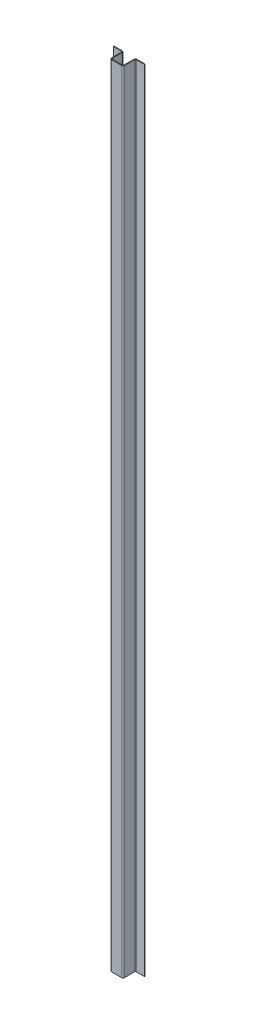
from build123d import *

# Parameters (mm, degrees)
SKETCH1_W                      = 40
SKETCH1_H                      = 2428
BASE_FLANGE1_DEPTH             = 2
EDGE_FLANGE1_STRIP_W           = 13
EDGE_FLANGE1_STRIP_H           = 2
EDGE_FLANGE1_STRIP_CUT_DEPTH   = 2428
EDGE_FLANGE1_STRIP_2_W         = 13
EDGE_FLANGE1_STRIP_2_H         = 2
EDGE_FLANGE1_STRIP_CUT_2_DEPTH = 2428
EDGE_FLANGE1_DEPTH             = 2428
EDGE_FLANGE1_BEND_DEPTH        = 2428
EDGE_FLANGE2_STRIP_W           = 13
EDGE_FLANGE2_STRIP_H           = 2
EDGE_FLANGE2_STRIP_CUT_DEPTH   = 2428
EDGE_FLANGE2_STRIP_2_W         = 13
EDGE_FLANGE2_STRIP_2_H         = 2
EDGE_FLANGE2_STRIP_CUT_2_DEPTH = 2428
EDGE_FLANGE2_DEPTH             = 2428
EDGE_FLANGE2_BEND_DEPTH        = 2428


# Sheet-metal steps are written as plain solids
with BuildPart() as part:
    # Sketch1 → Base-Flange1 (new body)
    with BuildSketch(Plane.XY):
        Rectangle(SKETCH1_W, SKETCH1_H)
    extrude(amount=-BASE_FLANGE1_DEPTH)

    # Edge-Flange1 strip (across the edge) → Edge-Flange1 strip cut (cut)
    with BuildSketch(Plane(origin=(20, 1214, -2), x_dir=(-1, 0, 0), z_dir=(0, -1, 0))):
        with Locations((-2, -1)):
            Rectangle(EDGE_FLANGE1_STRIP_W, EDGE_FLANGE1_STRIP_H)
    extrude(amount=EDGE_FLANGE1_STRIP_CUT_DEPTH, mode=Mode.SUBTRACT)

    # Edge-Flange1 strip 2 (across the edge) → Edge-Flange1 strip cut 2 (cut)
    with BuildSketch(Plane(origin=(-20, -1214, -2), x_dir=(1, 0, 0), z_dir=(0, 1, 0))):
        with Locations((-2, -1)):
            Rectangle(EDGE_FLANGE1_STRIP_2_W, EDGE_FLANGE1_STRIP_2_H)
    extrude(amount=EDGE_FLANGE1_STRIP_CUT_2_DEPTH, mode=Mode.SUBTRACT)

    # Edge-Flange1 section (across the edge) → Edge-Flange1 (add)
    with BuildSketch(Plane(origin=(20, 1214, -2), x_dir=(-1, 0, 0), z_dir=(0, -1, 0))):
        with BuildLine():
            Line((0, 2.5), (0, 38))
            Line((0, 38), (2, 38))
            Line((2, 38), (2, 2.5))
            ThreePointArc((2, 2.5), (2.732233047, 0.732233047), (4.5, 0))
            Line((4.5, 0), (4.5, -2))
            ThreePointArc((4.5, -2), (1.318019485, -0.681980515), (0, 2.5))
        make_face()
    extrude(amount=EDGE_FLANGE1_DEPTH)

    # Edge-Flange1 section 2 (across the edge) → Edge-Flange1 bend (add)
    with BuildSketch(Plane(origin=(-20, -1214, -2), x_dir=(1, 0, 0), z_dir=(0, 1, 0))):
        with BuildLine():
            Line((0, 2.5), (0, 38))
            Line((0, 38), (2, 38))
            Line((2, 38), (2, 2.5))
            ThreePointArc((2, 2.5), (2.732233047, 0.732233047), (4.5, 0))
            Line((4.5, 0), (4.5, -2))
            ThreePointArc((4.5, -2), (1.318019485, -0.681980515), (0, 2.5))
        make_face()
    extrude(amount=EDGE_FLANGE1_BEND_DEPTH)

    # Edge-Flange2 strip (across the edge) → Edge-Flange2 strip cut (cut)
    with BuildSketch(Plane(origin=(-20, 1214, -40), x_dir=(0, 0, 1), z_dir=(0, -1, 0))):
        with Locations((-2, -1)):
            Rectangle(EDGE_FLANGE2_STRIP_W, EDGE_FLANGE2_STRIP_H)
    extrude(amount=EDGE_FLANGE2_STRIP_CUT_DEPTH, mode=Mode.SUBTRACT)

    # Edge-Flange2 strip 2 (across the edge) → Edge-Flange2 strip cut 2 (cut)
    with BuildSketch(Plane(origin=(20, -1214, -40), x_dir=(0, 0, 1), z_dir=(0, 1, 0))):
        with Locations((-2, -1)):
            Rectangle(EDGE_FLANGE2_STRIP_2_W, EDGE_FLANGE2_STRIP_2_H)
    extrude(amount=EDGE_FLANGE2_STRIP_CUT_2_DEPTH, mode=Mode.SUBTRACT)

    # Edge-Flange2 section (across the edge) → Edge-Flange2 (add)
    with BuildSketch(Plane(origin=(-20, 1214, -40), x_dir=(0, 0, 1), z_dir=(0, -1, 0))):
        with BuildLine():
            Line((0, 2.5), (0, 28))
            Line((0, 28), (2, 28))
            Line((2, 28), (2, 2.5))
            ThreePointArc((2, 2.5), (2.732233047, 0.732233047), (4.5, 0))
            Line((4.5, 0), (4.5, -2))
            ThreePointArc((4.5, -2), (1.318019485, -0.681980515), (0, 2.5))
        make_face()
    extrude(amount=EDGE_FLANGE2_DEPTH)

    # Edge-Flange2 section 2 (across the edge) → Edge-Flange2 bend (add)
    with BuildSketch(Plane(origin=(20, -1214, -40), x_dir=(0, 0, 1), z_dir=(0, 1, 0))):
        with BuildLine():
            Line((0, 2.5), (0, 28))
            Line((0, 28), (2, 28))
            Line((2, 28), (2, 2.5))
            ThreePointArc((2, 2.5), (2.732233047, 0.732233047), (4.5, 0))
            Line((4.5, 0), (4.5, -2))
            ThreePointArc((4.5, -2), (1.318019485, -0.681980515), (0, 2.5))
        make_face()
    extrude(amount=EDGE_FLANGE2_BEND_DEPTH)


solid = part.part
